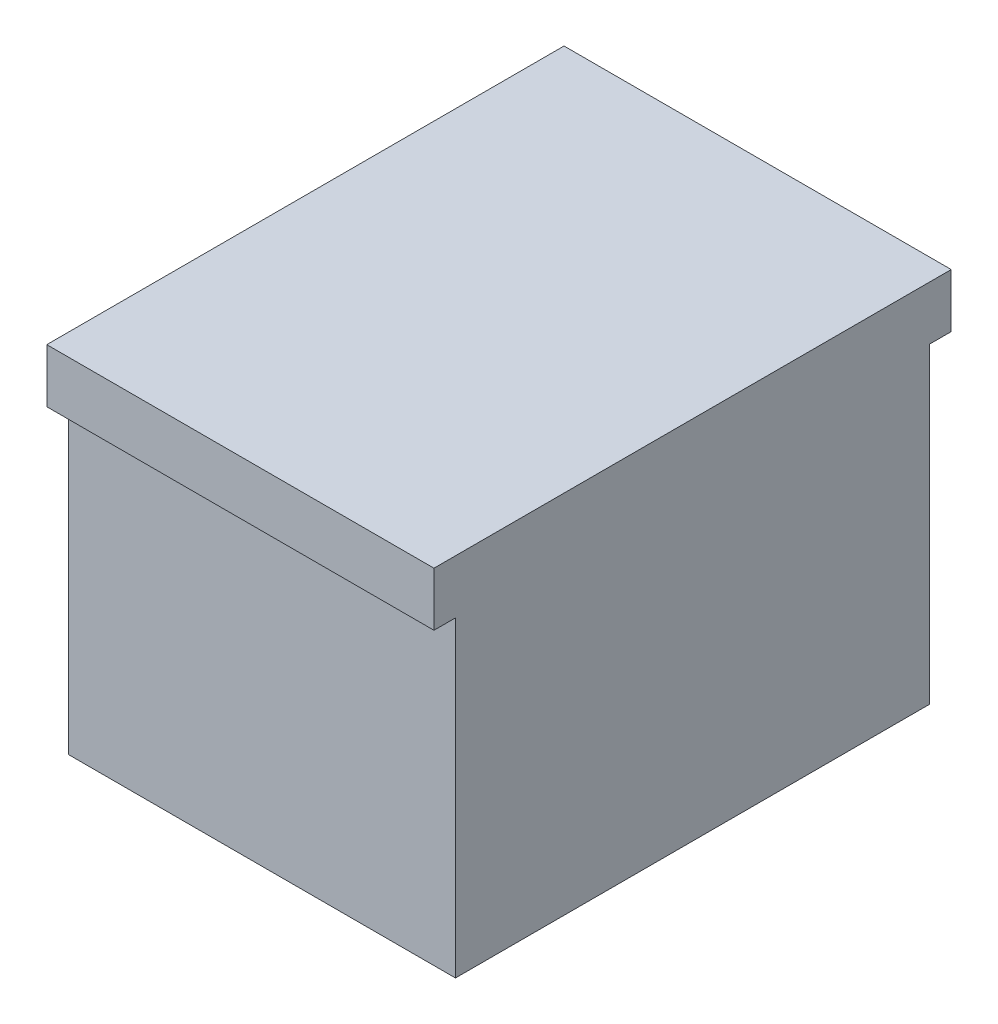
from build123d import *

# Parameters (mm, degrees)
SKETCH1_W                = 228.6
SKETCH1_H                = 280
BOSS_EXTRUDE1_DEPTH      = 215.9
M5_CLEARANCE_HOLE1_D     = 5.5
M5_CLEARANCE_HOLE1_DEPTH = 40
M5_CLEARANCE_HOLE1_TIP   = 1.652366702
SKETCH4_R                = 7.3787
SKETCH4_R_2              = 2.75
BOSS_EXTRUDE2_DEPTH      = 10.5918
SKETCH5_W                = 228.6
SKETCH5_H                = 305.4
BOSS_EXTRUDE3_DEPTH      = 31.75


with BuildPart() as part:
    # Sketch1 → Boss-Extrude1 (new body)
    with BuildSketch(Plane(origin=(0, 0, 0), x_dir=(1, 0, 0), z_dir=(0, 1, 0))):
        Rectangle(SKETCH1_W, SKETCH1_H)
    extrude(amount=BOSS_EXTRUDE1_DEPTH)

    # M5 Clearance Hole1
    with Locations(Plane(origin=(0, 0, 0), x_dir=(-1, 0, 0), z_dir=(0, -1, 0))):
        with Locations((-76.2, -5.38), (57.683542155, 70.566), (57.683542155, -81.326)):
            Hole(M5_CLEARANCE_HOLE1_D / 2, depth=M5_CLEARANCE_HOLE1_DEPTH)
            with Locations((0, 0, -(M5_CLEARANCE_HOLE1_DEPTH + M5_CLEARANCE_HOLE1_TIP / 2))):  # 118° drill point
                Cone(0, M5_CLEARANCE_HOLE1_D / 2, M5_CLEARANCE_HOLE1_TIP, mode=Mode.SUBTRACT)

    # Sketch4 → Boss-Extrude2 (add)
    # profile 1 of 2: a face of its own
    with BuildSketch(Plane.XZ):
        with Locations((-57.683542155, -70.566)):
            Circle(SKETCH4_R)
        with Locations((-57.683542155, -70.566)):
            Circle(SKETCH4_R_2, mode=Mode.SUBTRACT)
    # profile 2 of 2: a face of its own
    with BuildSketch(Plane.XZ):
        with Locations((-57.683542155, 81.326)):
            Circle(SKETCH4_R)
        with Locations((-57.683542155, 81.326)):
            Circle(SKETCH4_R_2, mode=Mode.SUBTRACT)
    extrude(amount=BOSS_EXTRUDE2_DEPTH)

    # Sketch5 → Boss-Extrude3 (add)
    with BuildSketch(Plane(origin=(0, 215.9, 0), x_dir=(1, 0, 0), z_dir=(0, 1, 0))):
        Rectangle(SKETCH5_W, SKETCH5_H)
    extrude(amount=-BOSS_EXTRUDE3_DEPTH)


solid = part.part
